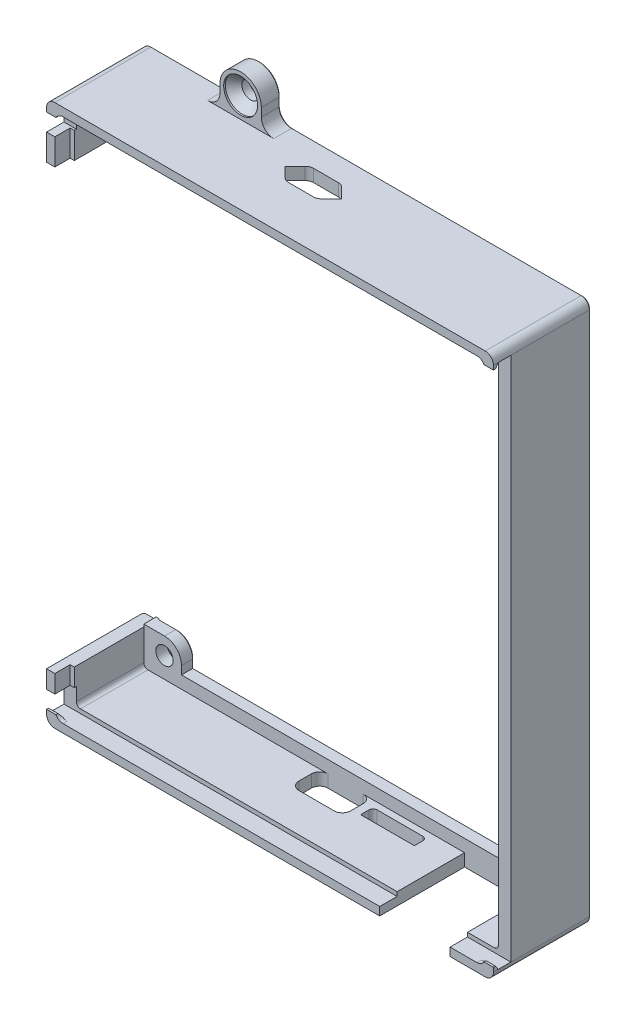
from build123d import *
from OCP.BRepFilletAPI import BRepFilletAPI_MakeChamfer

# Parameters (mm, degrees)
SKETCH2_R           = 2.1
BOSS_EXTRUDE1_DEPTH = 23.5
FILLET1_R           = 2
CUT_EXTRUDE3_DEPTH  = 20.5
CUT_EXTRUDE4_DEPTH  = 202.847691138
SKETCH7_W           = 12.5
SKETCH7_H           = 7
SKETCH7_W_2         = 13
SKETCH7_H_2         = 3
CUT_EXTRUDE5_DEPTH  = 3
CUT_EXTRUDE6_DEPTH  = 3.7
FILLET3_R           = 3
CHAMFER3_SIZE       = 0.3
FILLET2_R           = 2
CUT_EXTRUDE7_REACH  = 173.503
SKETCH10_W          = 19.960393728
SKETCH10_H          = 10
CUT_EXTRUDE8_DEPTH  = 18.9
CUT_EXTRUDE9_DEPTH  = 203.174405941
SKETCH12_R          = 4.1
CUT_EXTRUDE10_DEPTH = 0.4
CHAMFER4_SIZE       = 2
CUT_EXTRUDE11_REACH = 204.085
CUT_EXTRUDE12_DEPTH = 201.497753645
CHAMFER5_SIZE       = 0.7
CHAMFER5_SIZE2      = 0.5
FILLET4_R           = 1
CHAMFER6_SIZE       = 0.5
CHAMFER6_SIZE2      = 0.7


with BuildPart() as part:
    # Sketch2 → Boss-Extrude1 (new body)
    with BuildSketch(Plane.XY):
        with BuildLine():
            Line((0.167188, 159.1806075), (0.167188, 28.18105))
            Line((0.167188, 28.18105), (108.16728925, 28.18105))
            Line((108.16728925, 28.18105), (108.16728925, 159.1806075))
            Line((108.16728925, 159.1806075), (33.16763175, 159.1806075))
            Line((33.16763175, 159.1806075), (33.16763175, 164.1806075))
            ThreePointArc((33.16763175, 164.1806075), (28.16763175, 169.1806075), (23.16763175, 164.1806075))
            Line((23.16763175, 164.1806075), (23.16763175, 159.1806075))
            Line((23.16763175, 159.1806075), (0.167188, 159.1806075))
        make_face()
        with Locations((8.16763175, 151.18016)):
            Circle(SKETCH2_R, mode=Mode.SUBTRACT)
        with Locations((100.1668405, 151.18016)):
            Circle(SKETCH2_R, mode=Mode.SUBTRACT)
        with Locations((100.1668405, 36.181495625)):
            Circle(SKETCH2_R, mode=Mode.SUBTRACT)
        with Locations((8.167632375, 36.181495625)):
            Circle(SKETCH2_R, mode=Mode.SUBTRACT)
        with Locations((28.16763175, 164.1806075)):
            Circle(SKETCH2_R, mode=Mode.SUBTRACT)
    extrude(amount=BOSS_EXTRUDE1_DEPTH)

    # Fillet1
    fillet1_edges = [part.edges().sort_by_distance(p)[0] for p in [
        (108.16728925, 159.1806075, 11.75),
        (108.16728925, 28.18105, 11.75),
        (0.167188, 28.18105, 11.75),
        (0.167188, 159.1806075, 11.75),
    ]]
    fillet(fillet1_edges, radius=FILLET1_R)

    # Sketch5 → Cut-Extrude3 (cut)
    with BuildSketch(Plane.XY.offset(23.5)):
        with BuildLine():
            Line((4.167188, 156.1806075), (104.16728925, 156.1806075))
            ThreePointArc((104.16728925, 156.1806075), (104.874396031, 155.887714281), (105.16728925, 155.1806075))
            Line((105.16728925, 155.1806075), (105.16728925, 32.18105))
            ThreePointArc((105.16728925, 32.18105), (104.874396031, 31.473943219), (104.16728925, 31.18105))
            Line((104.16728925, 31.18105), (97.68774925, 31.18105))
            Line((97.68774925, 31.18105), (97.68774925, 28.18105))
            Line((97.68774925, 28.18105), (80.68774925, 28.18105))
            Line((80.68774925, 28.18105), (80.68774925, 31.18105))
            Line((80.68774925, 31.18105), (4.167188, 31.18105))
            ThreePointArc((4.167188, 31.18105), (3.460081219, 31.473943219), (3.167188, 32.18105))
            Line((3.167188, 32.18105), (3.167188, 155.1806075))
            ThreePointArc((3.167188, 155.1806075), (3.460081219, 155.887714281), (4.167188, 156.1806075))
        make_face()
    extrude(amount=-CUT_EXTRUDE3_DEPTH, mode=Mode.SUBTRACT)

    # Sketch6 → Cut-Extrude4 (cut, through all)
    with BuildSketch(Plane.XY.offset(3)):
        with BuildLine():
            Line((8.167632375, 147.080160625), (4.167188, 147.080160625))
            Line((4.167188, 147.080160625), (4.167188, 40.281495625))
            Line((4.167188, 40.281495625), (8.167632375, 40.281495625))
            ThreePointArc((8.167632375, 40.281495625), (11.066770178, 39.080633428), (12.267632375, 36.181495625))
            Line((12.267632375, 36.181495625), (12.267632375, 34.181272812))
            Line((12.267632375, 34.181272812), (96.0668405, 34.181272813))
            Line((96.0668405, 34.181272813), (96.0668405, 36.181495625))
            ThreePointArc((96.0668405, 36.181495625), (97.267702697, 39.080633428), (100.1668405, 40.281495625))
            Line((100.1668405, 40.281495625), (102.667064875, 40.281495625))
            Line((102.667064875, 40.281495625), (102.667064875, 72.68082875))
            Line((102.667064875, 72.68082875), (102.667064875, 114.68082875))
            Line((102.667064875, 114.68082875), (102.667064875, 147.080160625))
            Line((102.667064875, 147.080160625), (100.1668405, 147.080160625))
            ThreePointArc((100.1668405, 147.080160625), (97.267702697, 148.281022822), (96.0668405, 151.180160625))
            Line((96.0668405, 151.180160625), (96.0668405, 153.680384062))
            Line((96.0668405, 153.680384062), (12.267632375, 153.680384062))
            Line((12.267632375, 153.680384062), (12.267632375, 151.180160625))
            ThreePointArc((12.267632375, 151.180160625), (11.066770178, 148.281022822), (8.167632375, 147.080160625))
        make_face()
    extrude(amount=-CUT_EXTRUDE4_DEPTH, mode=Mode.SUBTRACT)

    # Sketch7 → Cut-Extrude5 (cut)
    with BuildSketch(Plane(origin=(0, 28.18105, 31.18105), x_dir=(1, 0, 0), z_dir=(0, 1, 0))):
        with Locations((51.91728925, 24.68105)):
            Rectangle(SKETCH7_W, SKETCH7_H)
        with Locations((66.66728925, 25.08105)):
            Rectangle(SKETCH7_W_2, SKETCH7_H_2)
    extrude(amount=CUT_EXTRUDE5_DEPTH, mode=Mode.SUBTRACT)

    # Sketch8 → Cut-Extrude6 (cut)
    with BuildSketch(Plane.XY.offset(23.5)):
        with BuildLine():
            Line((4.167188, 157.1806075), (104.16728925, 157.1806075))
            ThreePointArc((104.16728925, 157.1806075), (105.581502812, 156.594821062), (106.16728925, 155.1806075))
            Line((106.16728925, 155.1806075), (106.16728925, 32.18105))
            ThreePointArc((106.16728925, 32.18105), (105.581502812, 30.766836438), (104.16728925, 30.18105))
            Line((104.16728925, 30.18105), (4.167188, 30.18105))
            ThreePointArc((4.167188, 30.18105), (2.752974438, 30.766836438), (2.167188, 32.18105))
            Line((2.167188, 32.18105), (2.167188, 155.1806075))
            ThreePointArc((2.167188, 155.1806075), (2.752974438, 156.594821062), (4.167188, 157.1806075))
        make_face()
    extrude(amount=-CUT_EXTRUDE6_DEPTH, mode=Mode.SUBTRACT)

    # Fillet3
    fillet3_edges = [part.edges().sort_by_distance(p)[0] for p in [
        (23.16763175, 159.1806075, 11.75),
        (33.16763175, 159.1806075, 11.75),
    ]]
    fillet(fillet3_edges, radius=FILLET3_R)

    # Chamfer3
    chamfer3_edges = [part.edges().sort_by_distance(p)[0] for p in [
        (11.066770178, 148.281022822, 0),
        (12.267632375, 152.430272344, 0),
        (54.167236438, 153.680384062, 0),
        (96.0668405, 152.430272344, 0),
        (97.267702697, 148.281022822, 0),
        (101.416952688, 147.080160625, 0),
        (102.667064875, 93.680828125, 0),
        (101.416952688, 40.281495625, 0),
        (97.267702697, 39.080633428, 0),
        (96.0668405, 35.181384219, 0),
        (54.167236438, 34.181272813, 0),
        (12.267632375, 35.181384219, 0),
        (11.066770178, 39.080633428, 0),
        (6.167410188, 40.281495625, 0),
        (4.167188, 93.680828125, 0),
        (6.167410188, 147.080160625, 0),
        (6.06763175, 151.18016, 0),
        (11.167409875, 159.1806075, 0),
        (26.06763175, 164.1806075, 0),
        (33.16763175, 163.1806075, 0),
        (22.288952094, 160.059287156, 0),
        (34.046311406, 160.059287156, 0),
        (98.0668405, 151.18016, 0),
        (98.0668405, 36.181495625, 0),
        (6.067632375, 36.181495625, 0),
        (71.1674605, 159.1806075, 0),
        (108.16728925, 93.68082875, 0),
        (54.167238625, 28.18105, 0),
        (0.167188, 93.68082875, 0),
        (107.581502812, 28.766836438, 0),
        (0.752974438, 28.766836438, 0),
        (0.752974438, 158.594821062, 0),
        (107.581502812, 158.594821062, 0),
        (23.16763175, 163.1806075, 0),
        (28.16763175, 169.1806075, 0),
    ]]
    chamfer(chamfer3_edges, length=CHAMFER3_SIZE)

    # Fillet2
    fillet2_edges = [part.edges().sort_by_distance(p)[0] for p in [
        (45.66728925, 29.68105, 3),
        (45.66728925, 29.68105, 10),
        (58.16728925, 29.68105, 10),
        (58.16728925, 29.68105, 3),
    ]]
    fillet(fillet2_edges, radius=FILLET2_R)

    # Sketch9 → Cut-Extrude7 (cut, up to next)
    with BuildSketch(Plane(origin=(0, 159.1806075, 0), x_dir=(1, 0, 0), z_dir=(0, 1, 0)), mode=Mode.PRIVATE) as cut_extrude7_sk1:
        with BuildLine():
            Line((45.752974438, -11.414213562), (43.338760875, -9))
            Line((43.338760875, -9), (45.752974438, -6.585786438))
            ThreePointArc((45.752974438, -6.585786438), (46.401821135, -6.152240935), (47.167188, -6))
            Line((47.167188, -6), (53.167188, -6))
            ThreePointArc((53.167188, -6), (53.932554865, -6.152240935), (54.581401562, -6.585786438))
            Line((54.581401562, -6.585786438), (56.995615125, -9))
            Line((56.995615125, -9), (54.581401562, -11.414213562))
            ThreePointArc((54.581401562, -11.414213562), (53.932554865, -11.847759065), (53.167188, -12))
            Line((53.167188, -12), (47.167188, -12))
            ThreePointArc((47.167188, -12), (46.401821135, -11.847759065), (45.752974438, -11.414213562))
        make_face()
    cut_extrude7_tool1 = extrude(cut_extrude7_sk1.sketch, amount=-CUT_EXTRUDE7_REACH, mode=Mode.PRIVATE) & part.part
    add(cut_extrude7_tool1.solids().sort_by_distance((50.167188, 159.180608, 9))[0], mode=Mode.SUBTRACT)

    # Sketch10 → Cut-Extrude8 (cut)
    with BuildSketch(Plane.XY.offset(23.5)):
        with Locations((27.864245701, 164.1806075)):
            Rectangle(SKETCH10_W, SKETCH10_H)
    extrude(amount=-CUT_EXTRUDE8_DEPTH, mode=Mode.SUBTRACT)

    # Sketch11 → Cut-Extrude9 (cut, through all)
    with BuildSketch(Plane.XY.offset(23.5)):
        Polygon((3.167188, 39.681495625), (3.167188, 40.281495625), (15.264041366, 40.281495625), (15.264041366, 145.68016), (-12.176606701, 145.68016), (-12.176606701, 39.681495625), align=None)
    extrude(amount=-CUT_EXTRUDE9_DEPTH, mode=Mode.SUBTRACT)

    # Sketch12 → Cut-Extrude10 (cut)
    with BuildSketch(Plane.XY.offset(4.6)):
        with Locations((28.16763175, 164.1806075)):
            Circle(SKETCH12_R)
    extrude(amount=-CUT_EXTRUDE10_DEPTH, mode=Mode.SUBTRACT)

    # Chamfer4
    chamfer4_edges = [part.edges().sort_by_distance(p)[0] for p in [
        (26.06763175, 164.1806075, 4.2),
    ]]
    chamfer(chamfer4_edges, length=CHAMFER4_SIZE - 0.0001)  # a hair under: the kernel refuses the full size

    # Cut-Extrude11: up to this face of the body (flat: up to its plane)
    cut_extrude11_end = Plane(part.part.faces().sort_by_distance((3.167188, 150.43038375, 11.4))[0])
    # Sketch13 → Cut-Extrude11 (cut, up to the picked face)
    with BuildSketch(Plane(origin=(108.16728925, 0, 0), x_dir=(0, 0, -1), z_dir=(1, 0, 0)), mode=Mode.PRIVATE) as cut_extrude11_sk1:
        Polygon((-22.5, 30.18105), (-19.3, 30.18105), (-19.3, 157.1806075), (-22.5, 157.1806075), (-22.5, 156.1806075), (-23.5, 156.1806075), (-23.5, 31.18105), (-22.5, 31.18105), align=None)
    cut_extrude11_tool1 = split(extrude(cut_extrude11_sk1.sketch, amount=-CUT_EXTRUDE11_REACH, mode=Mode.PRIVATE), bisect_by=cut_extrude11_end, keep=Keep.BOTH, mode=Mode.PRIVATE)
    add(cut_extrude11_tool1.solids().sort_by(Axis((108.167289, 93.680829, 21.393978), (-1, 0, 0)))[0], mode=Mode.SUBTRACT)

    # Sketch14 → Cut-Extrude12 (cut, through all)
    with BuildSketch(Plane(origin=(3.167188, 0, 0), x_dir=(0, 0, -1), z_dir=(1, 0, 0))):
        Polygon((-22.5, 156.1806075), (-23.5, 156.1806075), (-23.5, 152.004480549), (-22.997704515, 152.004480549), (-19.3, 152.004480549), (-19.3, 157.1806075), (-22.5, 157.1806075), align=None)
        Polygon((-19.3, 30.18105), (-22.5, 30.18105), (-22.5, 31.18105), (-23.5, 31.18105), (-23.5, 35.357176951), (-23, 35.357176951), (-19.3, 35.357176951), align=None)
    extrude(amount=-CUT_EXTRUDE12_DEPTH, mode=Mode.SUBTRACT)

    # Chamfer5: one chamfer whose edges measure the first distance from different faces: ONE call of the kernel's chamfer builder (chamfer() names one face for all edges)
    chamfer5_edges_1 = [part.edges().sort_by_distance(p)[0] for p in [
        (107.033314654, 156.1806075, 22.5),
    ]]
    chamfer5_side_1 = [part.faces().sort_by_distance(p)[0] for p in [
        (106.75301169, 156.720477082, 22.5),
    ]]
    chamfer5_edges_2 = [part.edges().sort_by_distance(p)[0] for p in [
        (1.301162596, 156.1806075, 22.5),
    ]]
    chamfer5_side_2 = [part.faces().sort_by_distance(p)[0] for p in [
        (1.58146556, 156.720477082, 22.5),
    ]]
    chamfer5 = BRepFilletAPI_MakeChamfer(part.part.solid().wrapped)
    for e in chamfer5_edges_1:
        chamfer5.Add(CHAMFER5_SIZE, CHAMFER5_SIZE2, e.wrapped, chamfer5_side_1[0].wrapped)  # the first distance lies on this face
    for e in chamfer5_edges_2:
        chamfer5.Add(CHAMFER5_SIZE, CHAMFER5_SIZE2, e.wrapped, chamfer5_side_2[0].wrapped)  # the first distance lies on this face
    add(Compound.cast(chamfer5.Shape()), mode=Mode.REPLACE)

    # Fillet4
    fillet4_edges = [part.edges().sort_by_distance(p)[0] for p in [
        (60.16728925, 29.68105, 4.6),
        (73.16728925, 29.68105, 4.6),
    ]]
    fillet(fillet4_edges, radius=FILLET4_R)

    # Chamfer6: one chamfer whose edges measure the first distance from different faces: ONE call of the kernel's chamfer builder (chamfer() names one face for all edges)
    chamfer6_edges_1 = [part.edges().sort_by_distance(p)[0] for p in [
        (107.033314654, 31.18105, 22.5),
    ]]
    chamfer6_side_1 = [part.faces().sort_by_distance(p)[0] for p in [
        (107.033314654, 31.18105, 23),
    ]]
    chamfer6_edges_2 = [part.edges().sort_by_distance(p)[0] for p in [
        (1.301162596, 31.18105, 22.5),
    ]]
    chamfer6_side_2 = [part.faces().sort_by_distance(p)[0] for p in [
        (1.301162596, 31.18105, 23),
    ]]
    chamfer6 = BRepFilletAPI_MakeChamfer(part.part.solid().wrapped)
    for e in chamfer6_edges_1:
        chamfer6.Add(CHAMFER6_SIZE, CHAMFER6_SIZE2, e.wrapped, chamfer6_side_1[0].wrapped)  # the first distance lies on this face
    for e in chamfer6_edges_2:
        chamfer6.Add(CHAMFER6_SIZE, CHAMFER6_SIZE2, e.wrapped, chamfer6_side_2[0].wrapped)  # the first distance lies on this face
    add(Compound.cast(chamfer6.Shape()), mode=Mode.REPLACE)


solid = part.part
